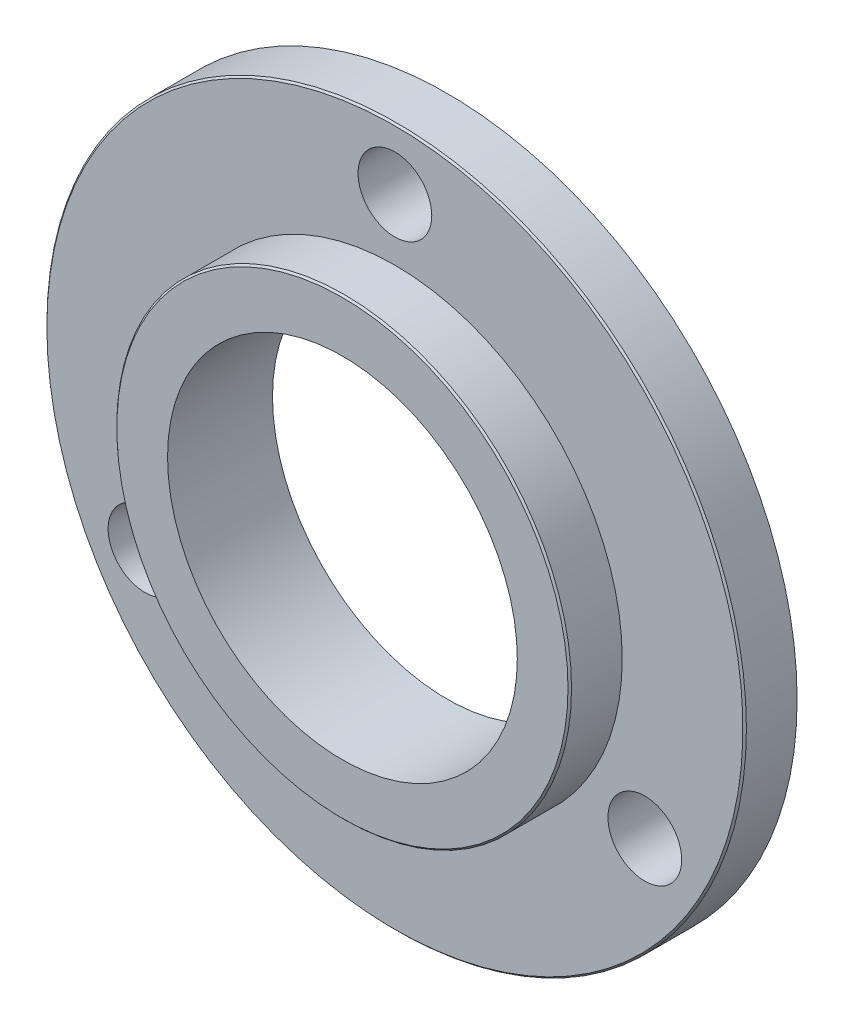
from build123d import *
from build123d.topology import SkipClean

# Parameters (mm, degrees)
ESQUISSE10_R       = 13
ESQUISSE10_R_2     = 10
BOSS_EXTRU_2_DEPTH = 3
BOSS_EXTRU_3_START = 3
ESQUISSE11_R       = 20
ESQUISSE11_R_2     = 10
BOSS_EXTRU_3_DEPTH = 3
CIRPATTERN1_COUNT  = 3
CHAMFER1_SIZE      = 0.1
CHAMFER2_SIZE      = 0.1


with BuildPart() as part:
    # Esquisse10 → Boss.-Extru.2 (new body)
    with BuildSketch(Plane.XY):
        Circle(ESQUISSE10_R)
        Circle(ESQUISSE10_R_2, mode=Mode.SUBTRACT)
    extrude(amount=BOSS_EXTRU_2_DEPTH)

    # Esquisse11 → Boss.-Extru.3 (add)
    with SkipClean():  # the faces are left unmerged after this step: merging them gives an invalid solid
        with BuildSketch(Plane(origin=(0, 0, 0), x_dir=(-1, 0, 0), z_dir=(0, 0, -1)).offset(BOSS_EXTRU_3_START)):
            Circle(ESQUISSE11_R)
            Circle(ESQUISSE11_R_2, mode=Mode.SUBTRACT)
        extrude(amount=-BOSS_EXTRU_3_DEPTH)

    # Sketch6 → Hole for #4 300® SC Nuts (SP)1 (revolve, cut)
    with SkipClean():  # the faces are left unmerged after this step: merging them gives an invalid solid
        with BuildSketch(Plane(origin=(0, 16.5, 0), x_dir=(0, -1, 0), z_dir=(1, 0, 0))):
            Polygon((0, 0), (0, 6.266734357), (2.1082, 5), (2.1082, 0), align=None)
        hole_for_4_300_sc_nuts_sp_1 = revolve(axis=Axis((0, 16.5, 6.35), (0, 0, -1)), mode=Mode.SUBTRACT)

    # CirPattern1: Hole for #4 300® SC Nuts (SP)1 ×3 about axis
    with SkipClean():  # the faces are left unmerged after this step: merging them gives an invalid solid
        cirpattern1_axis = Axis((0, 0, 3), (0, 0, -1))
        for i in range(1, CIRPATTERN1_COUNT):
            add(hole_for_4_300_sc_nuts_sp_1.rotate(cirpattern1_axis, i * 360 / CIRPATTERN1_COUNT), mode=Mode.SUBTRACT)

    # Chamfer1
    chamfer1_edges = [part.edges().sort_by_distance(p)[0] for p in [
        (20, 0, 0),
    ]]
    chamfer(chamfer1_edges, length=CHAMFER1_SIZE)

    # Chamfer2
    chamfer2_edges = [part.edges().sort_by_distance(p)[0] for p in [
        (-13, 0, 3),
    ]]
    chamfer(chamfer2_edges, length=CHAMFER2_SIZE)


solid = part.part
